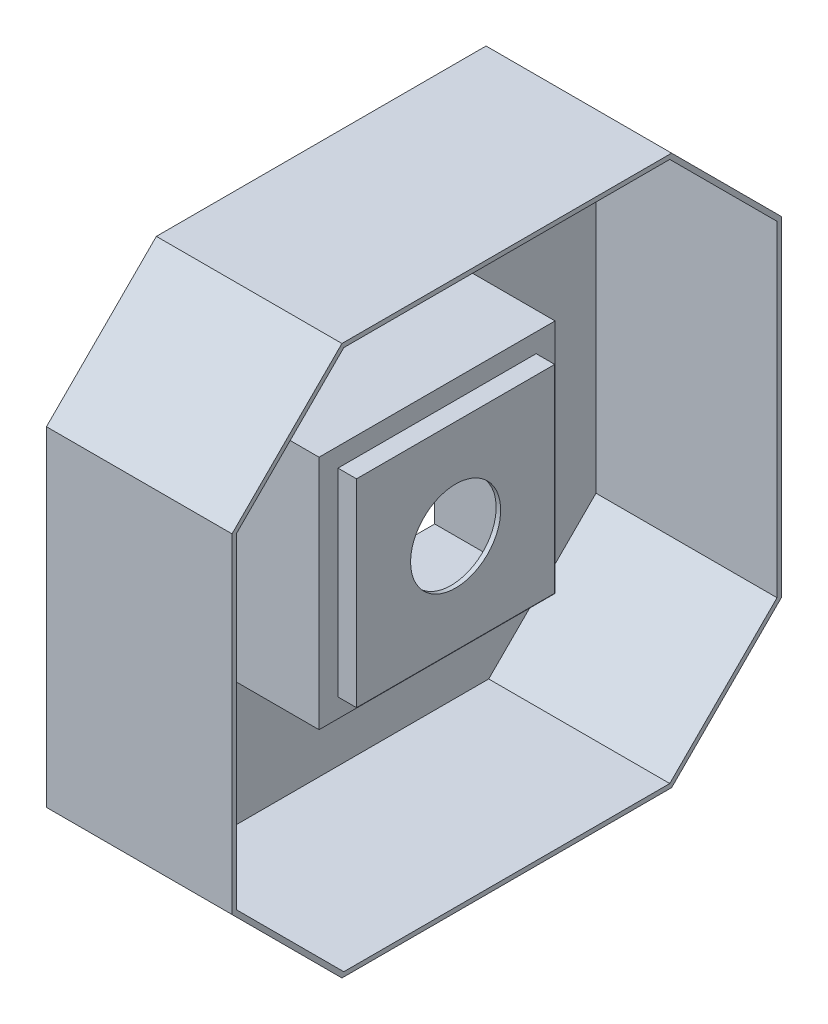
from build123d import *

# Parameters (mm, degrees)
EXTRUDE_1_DEPTH     = 206
SKETCH_5_W          = 252
SKETCH_5_H          = 252
CUT_EXTRUDE_1_DEPTH = 123.6
SKETCH_6_W          = 210
SKETCH_6_H          = 210
CUT_EXTRUDE_2_DEPTH = 144.2
SHELL_1_T           = -5
SKETCH_7_R          = 50
CUT_EXTRUDE_3_DEPTH = 455.80065963


with BuildPart() as part:
    # 草图2 → 凸台-拉伸1 (new body)
    with BuildSketch(Plane(origin=(0, 0, 0), x_dir=(0, 0, -1), z_dir=(1, 0, 0))):
        Polygon((-183, 305), (-305, 183), (-305, -183), (-183, -305), (183, -305), (305, -183), (305, 183), (183, 305), align=None)
    extrude(amount=EXTRUDE_1_DEPTH)

    # 草图5 → 切除-拉伸1 (cut)
    with BuildSketch(Plane(origin=(0, 0, 0), x_dir=(0, 0, -1), z_dir=(1, 0, 0))):
        Rectangle(SKETCH_5_W, SKETCH_5_H)
    extrude(amount=CUT_EXTRUDE_1_DEPTH, mode=Mode.SUBTRACT)

    # 草图6 → 切除-拉伸2 (cut)
    with BuildSketch(Plane.ZY):
        Rectangle(SKETCH_6_W, SKETCH_6_H)
    extrude(amount=-CUT_EXTRUDE_2_DEPTH, mode=Mode.SUBTRACT)

    # 抽壳1
    shell_1_openings = [part.faces().sort_by_distance(p)[0] for p in [
        (206, 0, 0),
    ]]
    offset(amount=SHELL_1_T, openings=shell_1_openings, kind=Kind.INTERSECTION)

    # 草图7 → 切除-拉伸3 (cut, through all)
    with BuildSketch(Plane.ZY.offset(-144.2)):
        Circle(SKETCH_7_R)
    extrude(amount=-CUT_EXTRUDE_3_DEPTH, mode=Mode.SUBTRACT)


solid = part.part
